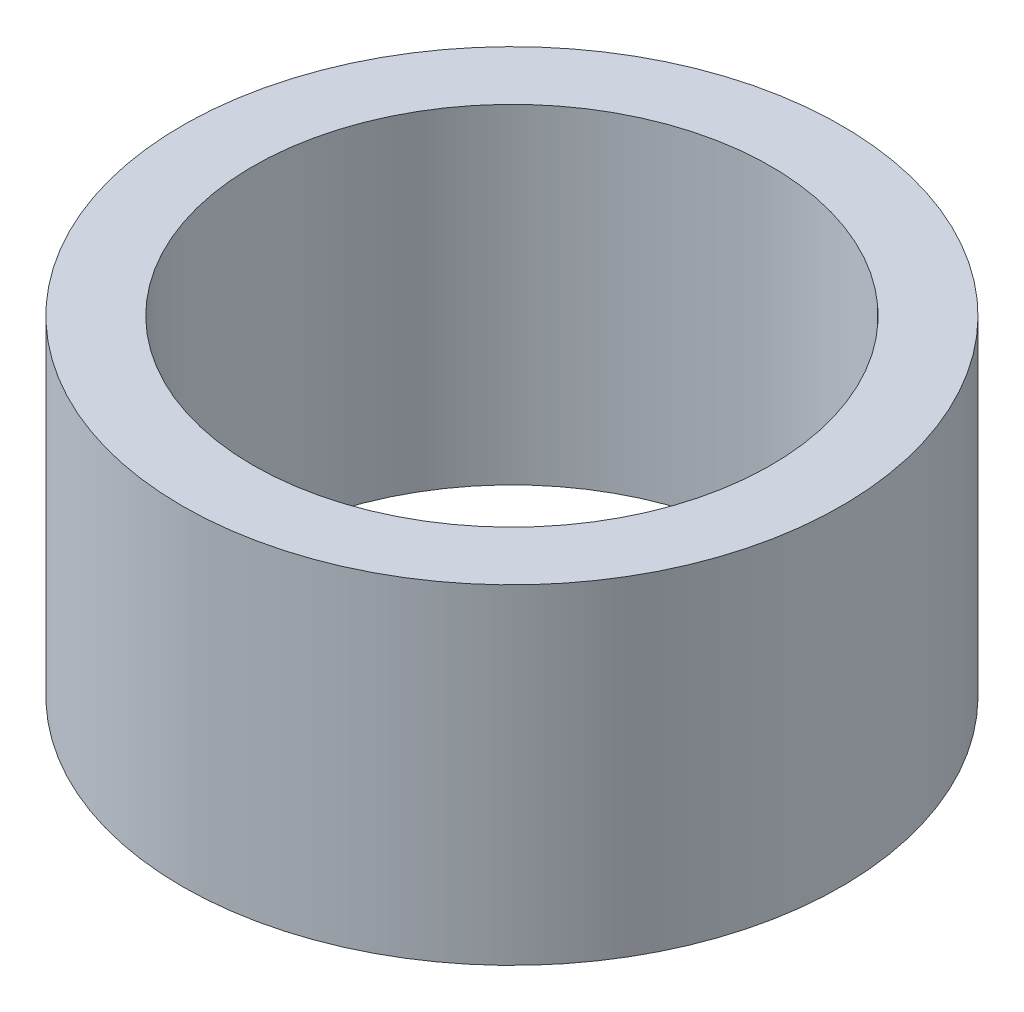
from build123d import *

# Parameters (mm, degrees)
ESQUISSE1_R        = 3.5
ESQUISSE1_R_2      = 2.75
BOSS_EXTRU_1_DEPTH = 3.5


with BuildPart() as part:
    # Esquisse1 → Boss.-Extru.1 (new body)
    with BuildSketch(Plane(origin=(0, 0, 0), x_dir=(1, 0, 0), z_dir=(0, 1, 0))):
        Circle(ESQUISSE1_R)
        Circle(ESQUISSE1_R_2, mode=Mode.SUBTRACT)
    extrude(amount=BOSS_EXTRU_1_DEPTH)


solid = part.part
